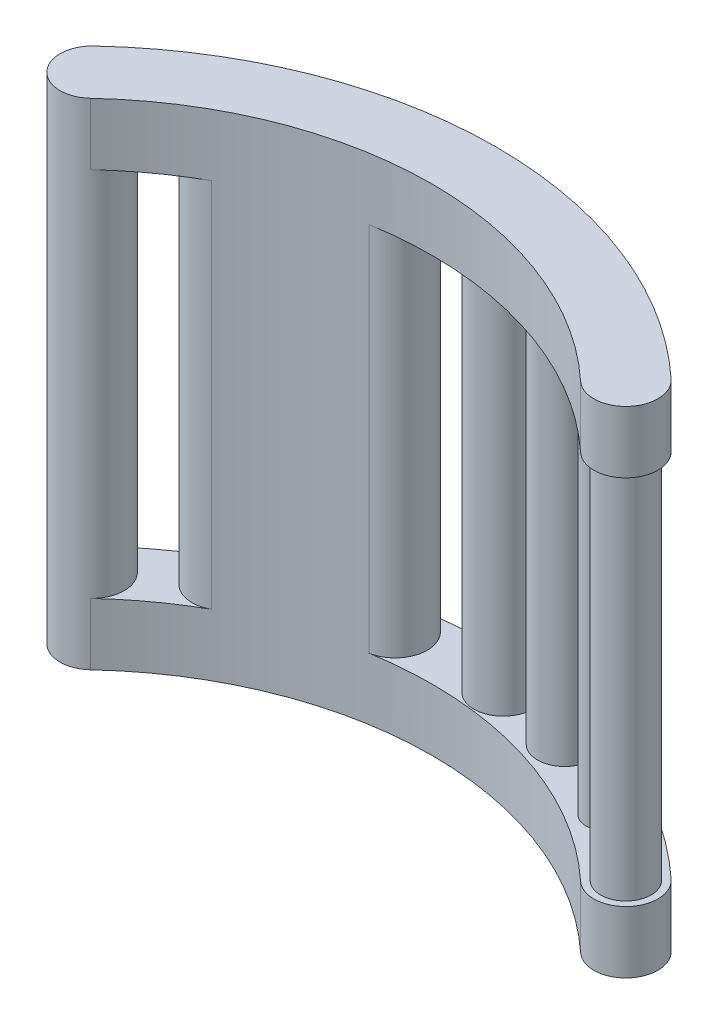
from build123d import *
from build123d.topology import SkipClean

# Parameters (mm, degrees)
BOSS_EXTRUDE1_DEPTH = 7.5
SKETCH2_R           = 3.066001566
SKETCH2_R_2         = 2.488658621
SKETCH2_R_3         = 3.287125566
SKETCH2_R_4         = 3.564275787
SKETCH2_R_5         = 3.883188156
BOSS_EXTRUDE2_DEPTH = 22.5
CUT_EXTRUDE5_START  = -8
CUT_EXTRUDE5_DEPTH  = 30


with BuildPart() as part:
    # Sketch1 → Boss-Extrude1 (new body)
    with BuildSketch(Plane(origin=(0, 0, 0), x_dir=(1, 0, 0), z_dir=(0, 1, 0))):
        with BuildLine():
            ThreePointArc((29.700859703, -5.677650318), (35.189255011, -5.488395308), (35, 0))
            ThreePointArc((35, 0), (0, 13.795711322), (-35, 0))
            ThreePointArc((-35, 0), (-35.189255011, -5.488395308), (-29.700859703, -5.677650318))
            ThreePointArc((-29.700859703, -5.677650318), (0, 6.029335009), (29.700859703, -5.677650318))
        make_face()
    boss_extrude1 = extrude(amount=BOSS_EXTRUDE1_DEPTH)

    # Sketch2 → Boss-Extrude2 (add)
    with BuildSketch(Plane(origin=(0, 7.5, 0), x_dir=(1, 0, 0), z_dir=(0, 1, 0))):
        with Locations((32.350429851, -2.838825159)):
            Circle(SKETCH2_R)
        with Locations((24.254858461, 2.946835549)):
            Circle(SKETCH2_R_2)
        with Locations((14.353489845, 7.725985565)):
            Circle(SKETCH2_R_3)
        with Locations((5.168420648, 9.491585346)):
            Circle(SKETCH2_R_4)
        with Locations((-32.350429851, -2.838825159)):
            Circle(SKETCH2_R_5)
        with BuildLine():
            ThreePointArc((-8.36333279, 13.10933377), (-16.926887011, 10.922417289), (-24.9879125, 7.297926614))
            ThreePointArc((-24.9879125, 7.297926614), (-26.487570272, 2.014998725), (-21.204642383, 0.515340953))
            ThreePointArc((-21.204642383, 0.515340953), (-14.364088466, 3.591069211), (-7.097090681, 5.44687777))
            ThreePointArc((-7.097090681, 5.44687777), (-3.898983736, 9.911226825), (-8.36333279, 13.10933377))
        make_face()
    boss_extrude2 = extrude(amount=BOSS_EXTRUDE2_DEPTH)

    # Mirror1: Boss-Extrude1, Boss-Extrude2 across plane
    with SkipClean():  # the faces are left unmerged after this step: merging them gives an invalid solid
        add(boss_extrude1.mirror(Plane.ZX.offset(30)))
        add(boss_extrude2.mirror(Plane.ZX.offset(30)))

    # Sketch5 → Cut-Extrude5 (cut)
    # profile 1 of 3: a face of its own
    with SkipClean():  # the faces are left unmerged after this step: merging them gives an invalid solid
        with BuildSketch(Plane.XY.offset(CUT_EXTRUDE5_START)):
            Polygon((-22.378904208, 9.627232141), (-22.378904208, 21.494861167), (-20.059258882, 21.494861167), (-20.059258882, 16.861046654), (-11.938909925, 16.861046654), (-11.938909925, 14.261046654), (-20.059258882, 14.261046654), (-20.059258882, 9.627232141), align=None)
        # profile 2 of 3: a face of its own
        with BuildSketch(Plane.XY.offset(CUT_EXTRUDE5_START)):
            Polygon((-22.378904208, 28.2034814), (-22.378904208, 31.986783309), (-11.938909925, 36.879426), (-11.938909925, 34.429426), (-15.470648505, 32.776786124), (-15.470648505, 27.409662297), (-11.938909925, 25.74903897), (-11.938909925, 23.294596539), align=None)
            Polygon((-17.158907066, 28.2034814), (-17.158907066, 31.986783309), (-21.188651419, 30.09826702), align=None, mode=Mode.SUBTRACT)
        # profile 3 of 3: a face of its own
        with BuildSketch(Plane.XY.offset(CUT_EXTRUDE5_START)):
            Polygon((-11.938909925, 40.490468935), (-14.357350459, 40.490468935), (-14.357350459, 46.299946257), (-22.378904208, 46.299946257), (-22.378904208, 48.80617053), (-11.938909925, 48.80617053), align=None)
        extrude(amount=-CUT_EXTRUDE5_DEPTH, mode=Mode.SUBTRACT)


solid = part.part
